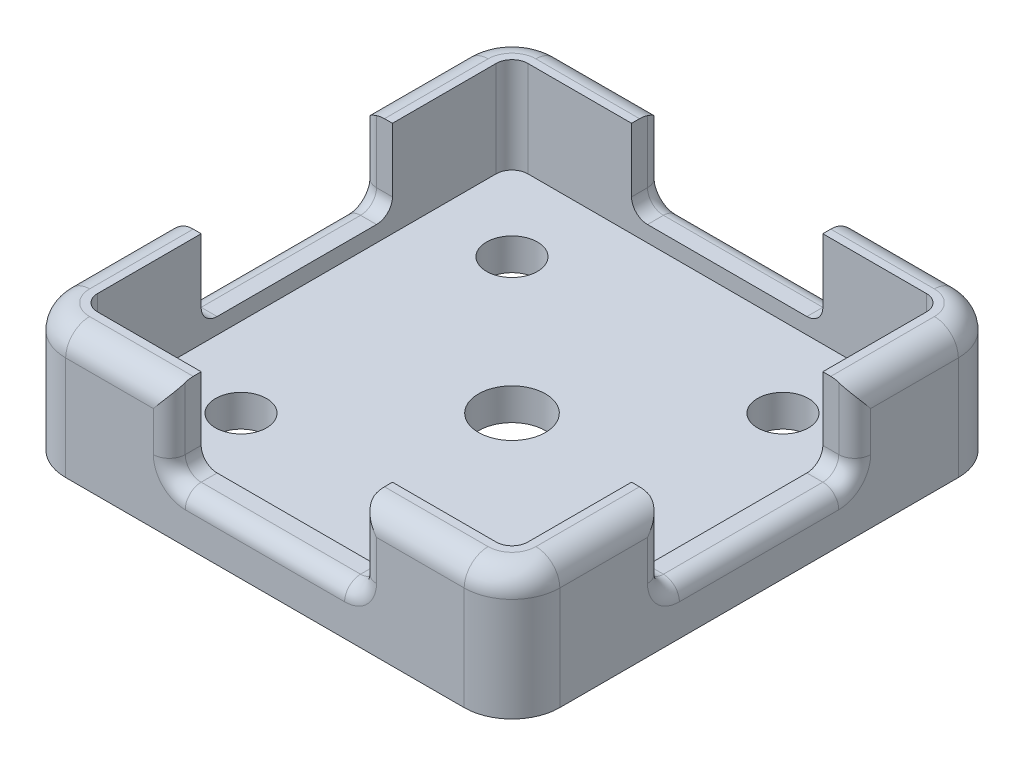
from build123d import *

# Parameters (mm, degrees)
SKETCH1_R               = 2.1
SKETCH1_R_2             = 1.6
BOSS_EXTRUDE1_DEPTH     = 10
CUT_EXTRUDE1_DEPTH      = 8
SKETCH3_W               = 12
SKETCH3_H               = 6
CUT_EXTRUDE2_DEPTH      = 35.369317712
CIRPATTERN1_COUNT       = 4
FILLET1_R               = 1
CUT_EXTRUDE3_DEPTH      = 25.093567606
CUT_EXTRUDE3_DEPTH_BACK = 25.093567606
SKETCH4_W               = 64.927368138
SKETCH4_H               = 2
FILLET2_R               = 1.5


# Some blends are built 0.0001 mm under size
with BuildPart() as part:
    # Sketch1 → Boss-Extrude1 (new body)
    with BuildSketch(Plane(origin=(0, 0, 0), x_dir=(1, 0, 0), z_dir=(0, 1, 0))):
        with BuildLine():
            Line((-12.5, -15.5), (12.5, -15.5))
            ThreePointArc((12.5, -15.5), (14.621320344, -14.621320344), (15.5, -12.5))
            Line((15.5, -12.5), (15.5, 12.5))
            ThreePointArc((15.5, 12.5), (14.621320344, 14.621320344), (12.5, 15.5))
            Line((12.5, 15.5), (-12.5, 15.5))
            ThreePointArc((-12.5, 15.5), (-14.621320344, 14.621320344), (-15.5, 12.5))
            Line((-15.5, 12.5), (-15.5, -12.5))
            ThreePointArc((-15.5, -12.5), (-14.621320344, -14.621320344), (-12.5, -15.5))
        make_face()
        with Locations(Location((0, 0, 0), (0, 0, 270))):
            Circle(SKETCH1_R, mode=Mode.SUBTRACT)
        with Locations(Location((-8.5, 8.5, 0), (0, 0, 270))):
            Circle(SKETCH1_R_2, mode=Mode.SUBTRACT)
        with Locations(Location((8.5, 8.5, 0), (0, 0, 270))):
            Circle(SKETCH1_R_2, mode=Mode.SUBTRACT)
        with Locations(Location((8.5, -8.5, 0), (0, 0, 270))):
            Circle(SKETCH1_R_2, mode=Mode.SUBTRACT)
        with Locations(Location((-8.5, -8.5, 0), (0, 0, 270))):
            Circle(SKETCH1_R_2, mode=Mode.SUBTRACT)
    extrude(amount=BOSS_EXTRUDE1_DEPTH)

    # Sketch2 → Cut-Extrude1 (cut)
    with BuildSketch(Plane(origin=(0, 10, 0), x_dir=(1, 0, 0), z_dir=(0, 1, 0))):
        with BuildLine():
            Line((-12.5, -13.5), (12.5, -13.5))
            ThreePointArc((12.5, -13.5), (13.207106781, -13.207106781), (13.5, -12.5))
            Line((13.5, -12.5), (13.5, 12.5))
            ThreePointArc((13.5, 12.5), (13.207106781, 13.207106781), (12.5, 13.5))
            Line((12.5, 13.5), (-12.5, 13.5))
            ThreePointArc((-12.5, 13.5), (-13.207106781, 13.207106781), (-13.5, 12.5))
            Line((-13.5, 12.5), (-13.5, -12.5))
            ThreePointArc((-13.5, -12.5), (-13.207106781, -13.207106781), (-12.5, -13.5))
        make_face()
    extrude(amount=-CUT_EXTRUDE1_DEPTH, mode=Mode.SUBTRACT)

    # Sketch3 → Cut-Extrude2 (cut, through all)
    with BuildSketch(Plane.XY.offset(-13.5)):
        with Locations((0, 6)):
            Rectangle(SKETCH3_W, SKETCH3_H)
    cut_extrude2 = extrude(amount=-CUT_EXTRUDE2_DEPTH, mode=Mode.SUBTRACT)

    # CirPattern1: Cut-Extrude2 ×4 about axis
    cirpattern1_axis = Axis((0, 0, 0), (0, 1, 0))
    for i in range(1, CIRPATTERN1_COUNT):
        add(cut_extrude2.rotate(cirpattern1_axis, i * 360 / CIRPATTERN1_COUNT), mode=Mode.SUBTRACT)

    # Fillet1
    fillet1_edges = [part.edges().sort_by_distance(p)[0] for p in [
        (-15.5, 6, 6),
        (-14.5, 3, 6),
        (-15.5, 9, 0),
        (-14.5, 9, 6),
        (-15.5, 6, -6),
        (-14.5, 9, -6),
        (-15.5, 3, 0),
        (-14.5, 3, -6),
        (6, 6, 15.5),
        (6, 3, 14.5),
        (0, 9, 15.5),
        (6, 9, 14.5),
        (-6, 6, 15.5),
        (-6, 9, 14.5),
        (0, 3, 15.5),
        (-6, 3, 14.5),
        (15.5, 6, -6),
        (14.5, 3, -6),
        (15.5, 9, 0),
        (14.5, 9, -6),
        (15.5, 6, 6),
        (14.5, 9, 6),
        (15.5, 3, 0),
        (14.5, 3, 6),
        (-6, 6, -15.5),
        (-6, 3, -14.5),
        (0, 9, -15.5),
        (-6, 9, -14.5),
        (6, 6, -15.5),
        (6, 9, -14.5),
        (0, 3, -15.5),
        (6, 3, -14.5),
    ]]
    fillet(fillet1_edges, radius=FILLET1_R - 0.0001)  # a hair under: the kernel refuses the full size

    # Sketch4 → Cut-Extrude3 (cut, two sides: drawn at the far end of the back side and taken through both)
    with BuildSketch(Plane(origin=(0, 0, 0), x_dir=(0, 0, -1), z_dir=(1, 0, 0)).offset(-CUT_EXTRUDE3_DEPTH_BACK)):
        with Locations((2.454919732, 9)):
            Rectangle(SKETCH4_W, SKETCH4_H)
    extrude(amount=CUT_EXTRUDE3_DEPTH + CUT_EXTRUDE3_DEPTH_BACK, mode=Mode.SUBTRACT)

    # Fillet2
    # the kernel refuses this fillet: 1.5 mm, written as the material it takes off along each edge
    with BuildSketch(Plane(origin=(12.5, 8, -12.5), x_dir=(0, 0, -1), z_dir=(-1, 0, 0))) as fillet2_piece_1:
        with BuildLine():
            CenterArc((3 - FILLET2_R, FILLET2_R), FILLET2_R, 270, 90)
            Line((3 - FILLET2_R, 0), (3, 0))
            Line((3, 0), (3, FILLET2_R))
        make_face()
    revolve(axis=Axis((12.5, 8, -12.5), (0, -1, 0)), revolution_arc=90, mode=Mode.SUBTRACT)
    with BuildSketch(Plane(origin=(3.2499, 8, -15.5), x_dir=(0, -1, 0), z_dir=(1, 0, 0)), Plane(origin=(15.5, 8, -12.5), x_dir=(0, -1, 0), z_dir=(0, 0, 1)), Plane(origin=(15.5, 8, 3.2499), x_dir=(0, -1, 0), z_dir=(0, 0, 1)), Plane(origin=(12.5, 8, 15.5), x_dir=(0, -1, 0), z_dir=(-1, 0, 0)), Plane(origin=(-15.5, 8, 12.5), x_dir=(0, -1, 0), z_dir=(0, 0, -1)), Plane(origin=(-15.5, 8, -3.2499), x_dir=(0, -1, 0), z_dir=(0, 0, -1))) as fillet2_piece_2:
        with BuildLine():
            CenterArc((FILLET2_R, -FILLET2_R), FILLET2_R, 90, 90)
            Line((0, -FILLET2_R), (0, 0))
            Line((0, 0), (FILLET2_R, 0))
        make_face()
    extrude(amount=9.2501, mode=Mode.SUBTRACT)
    with BuildSketch(Plane(origin=(12.5, 8, 12.5), x_dir=(1, 0, 0), z_dir=(0, 0, -1))) as fillet2_piece_3:
        with BuildLine():
            CenterArc((3 - FILLET2_R, FILLET2_R), FILLET2_R, 270, 90)
            Line((3 - FILLET2_R, 0), (3, 0))
            Line((3, 0), (3, FILLET2_R))
        make_face()
    revolve(axis=Axis((12.5, 8, 12.5), (0, -1, 0)), revolution_arc=90, mode=Mode.SUBTRACT)
    with BuildSketch(Plane(origin=(-3.2499, 8, 15.5), x_dir=(0, 0, -1), z_dir=(-1, 0, 0)), Plane(origin=(-12.5, 8, -15.5), x_dir=(0, 0, 1), z_dir=(1, 0, 0))) as fillet2_piece_4:
        with BuildLine():
            CenterArc((FILLET2_R, FILLET2_R), FILLET2_R, 180, 90)
            Line((0, FILLET2_R), (0, 0))
            Line((0, 0), (FILLET2_R, 0))
        make_face()
    extrude(amount=9.2501, mode=Mode.SUBTRACT)
    with BuildSketch(Plane(origin=(-12.5, 8, 12.5), x_dir=(0, 0, 1), z_dir=(1, 0, 0))) as fillet2_piece_5:
        with BuildLine():
            CenterArc((3 - FILLET2_R, FILLET2_R), FILLET2_R, 270, 90)
            Line((3 - FILLET2_R, 0), (3, 0))
            Line((3, 0), (3, FILLET2_R))
        make_face()
    revolve(axis=Axis((-12.5, 8, 12.5), (0, -1, 0)), revolution_arc=90, mode=Mode.SUBTRACT)
    with BuildSketch(Plane(origin=(-12.5, 8, -12.5), x_dir=(-1, 0, 0), z_dir=(0, 0, 1))) as fillet2_piece_6:
        with BuildLine():
            CenterArc((3 - FILLET2_R, FILLET2_R), FILLET2_R, 270, 90)
            Line((3, FILLET2_R), (3, 0))
            Line((3, 0), (3 - FILLET2_R, 0))
        make_face()
    revolve(axis=Axis((-12.5, 8, -12.5), (0, -1, 0)), revolution_arc=90, mode=Mode.SUBTRACT)


solid = part.part
